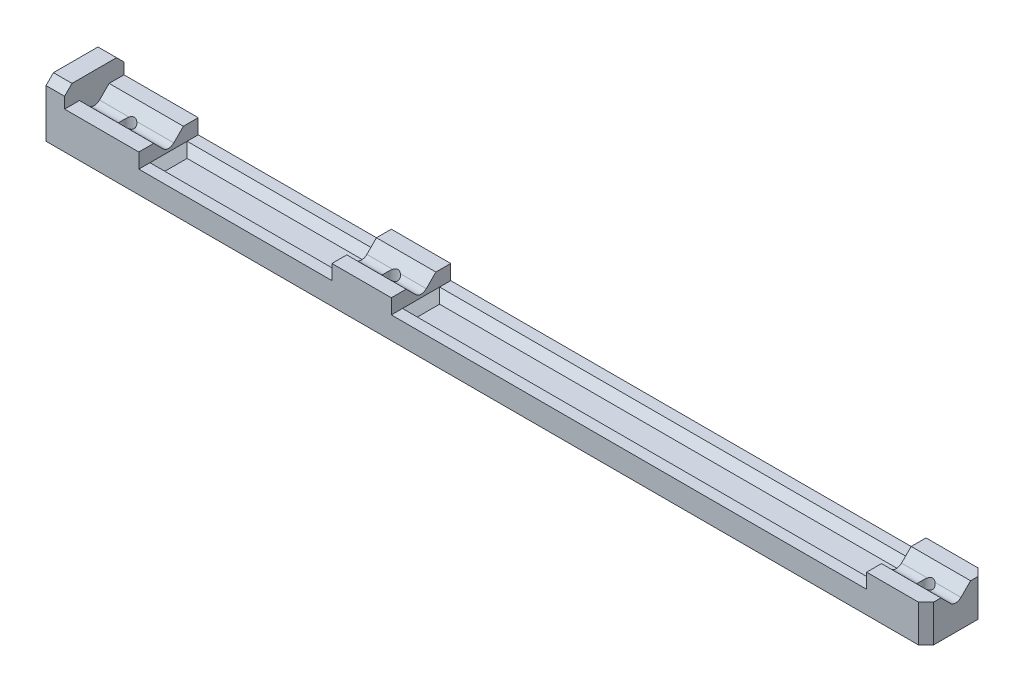
from build123d import *

# Parameters (mm, degrees)
EXTRUDE_1_DEPTH          = 20
SKETCH_2_W               = 16
SKETCH_2_H               = 15
EXTRUDE_2_DEPTH          = 5
EXTRUDE_3_DEPTH          = 210
EXTRUDE_4_DEPTH          = 8
PATTERN_LINEAR_1_COUNT   = 2
PATTERN_LINEAR_1_PITCH   = 144
FILLET_1_R               = 2
CHAMFER_1_SIZE           = 2
CUT_EXTRUDE_1_DEPTH      = 233.622010996
CUT_EXTRUDE_1_DEPTH_BACK = 233.622010996
SKETCH_5_R               = 1.75


with BuildPart() as part:
    # Эскиз1 → Бобышка-Вытянуть1 (new body)
    with BuildSketch(Plane(origin=(0, 0, 0), x_dir=(0, 0, -1), z_dir=(1, 0, 0))):
        Polygon((-8, 0), (8, 0), (8, 10), (4, 10), (0, 6), (-4, 10), (-8, 10), align=None)
    extrude(amount=EXTRUDE_1_DEPTH)

    # Эскиз2 → Бобышка-Вытянуть2 (add)
    with BuildSketch(Plane.ZY):
        with Locations((0, 7.5)):
            Rectangle(SKETCH_2_W, SKETCH_2_H)
    extrude(amount=EXTRUDE_2_DEPTH)

    # Эскиз3 → Бобышка-Вытянуть3 (add)
    with BuildSketch(Plane(origin=(20, 0, 0), x_dir=(0, 0, -1), z_dir=(1, 0, 0))):
        Polygon((-8, 0), (8, 0), (8, 4), (8, 6), (5, 6), (5, 4), (-5, 4), (-5, 6), (-8, 6), (-8, 4), align=None)
    extrude(amount=EXTRUDE_3_DEPTH)

    # Эскиз4 → Бобышка-Вытянуть4 (add, symmetric)
    with BuildSketch(Plane(origin=(80, 0, 0), x_dir=(0, 0, -1), z_dir=(1, 0, 0))):
        Polygon((-8, 0), (8, 0), (8, 10), (4, 10), (0, 6), (-4, 10), (-8, 10), align=None)
    extrude_4 = extrude(amount=EXTRUDE_4_DEPTH, both=True)

    # Линейный массив1: Бобышка-Вытянуть4 ×2
    with Locations(*[(i * PATTERN_LINEAR_1_PITCH, 0, 0) for i in range(1, PATTERN_LINEAR_1_COUNT)]):
        add(extrude_4)

    # Скругление1
    fillet_1_edges = [part.edges().sort_by_distance(p)[0] for p in [
        (224, 6, 0),
        (10, 6, 0),
        (80, 6, 0),
    ]]
    fillet(fillet_1_edges, radius=FILLET_1_R)

    # Фаска1
    chamfer_1_edges = [part.edges().sort_by_distance(p)[0] for p in [
        (232, 5, -8),
        (232, 5, 8),
        (216, 4, 0),
        (152, 4, -5),
        (88, 4, 0),
        (152, 4, 5),
        (20, 4, 0),
        (46, 4, 5),
        (72, 4, 0),
        (46, 4, -5),
        (-2.5, 15, -8),
        (-2.5, 15, 8),
    ]]
    chamfer(chamfer_1_edges, length=CHAMFER_1_SIZE - 0.0001)  # a hair under: the kernel refuses the full size

    # Эскиз5 → Вырез-Вытянуть1 (cut, two sides: drawn at the far end of the back side and taken through both)
    with BuildSketch(Plane.XZ.offset(-CUT_EXTRUDE_1_DEPTH_BACK)):
        with Locations(Location((9, 0, 0), (0, 0, 306.087147066))):
            Circle(SKETCH_5_R)
        with Locations(Location((80, 0, 0), (0, 0, 306.087147066))):
            Circle(SKETCH_5_R)
        with Locations(Location((224, 0, 0), (0, 0, 306.087147066))):
            Circle(SKETCH_5_R)
    extrude(amount=CUT_EXTRUDE_1_DEPTH + CUT_EXTRUDE_1_DEPTH_BACK, mode=Mode.SUBTRACT)


solid = part.part
